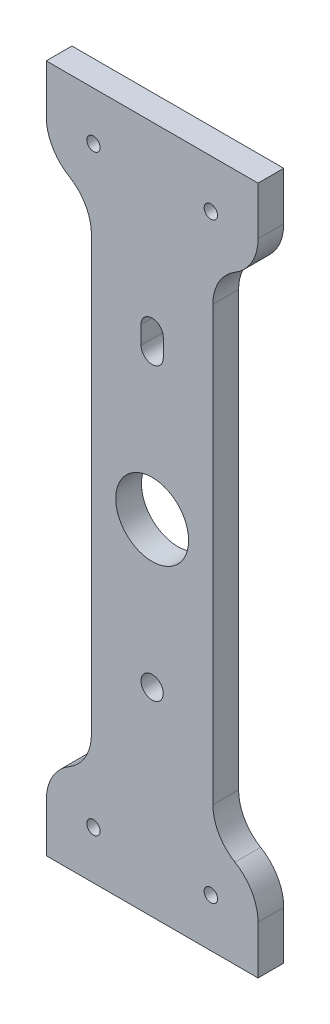
from build123d import *

# Parameters (mm, degrees)
SKETCH1_R           = 9
SKETCH1_R_2         = 1.65
SKETCH1_R_3         = 2.75
BOSS_EXTRUDE1_DEPTH = 6.35


with BuildPart() as part:
    # Sketch1 → Boss-Extrude1 (new body)
    with BuildSketch(Plane.XY):
        with BuildLine():
            Line((-15, -53.494834214), (-15, 53.494834214))
            ThreePointArc((-15, 53.494834214), (-16.458587943, 59.008365963), (-20.452741228, 63.079391714))
            ThreePointArc((-20.452741228, 63.079391714), (-24.626004526, 67.332974675), (-26.15, 73.09375))
            Line((-26.15, 73.09375), (-26.15, 85))
            Line((-26.15, 85), (26.15, 85))
            Line((26.15, 85), (26.15, 73.09375))
            ThreePointArc((26.15, 73.09375), (24.626004526, 67.332974675), (20.452741228, 63.079391714))
            ThreePointArc((20.452741228, 63.079391714), (16.458587943, 59.008365963), (15, 53.494834214))
            Line((15, 53.494834214), (15, -53.494834214))
            ThreePointArc((15, -53.494834214), (16.458587943, -59.008365963), (20.452741228, -63.079391714))
            ThreePointArc((20.452741228, -63.079391714), (24.626004526, -67.332974675), (26.15, -73.09375))
            Line((26.15, -73.09375), (26.15, -85))
            Line((26.15, -85), (-26.15, -85))
            Line((-26.15, -85), (-26.15, -73.09375))
            ThreePointArc((-26.15, -73.09375), (-24.626004526, -67.332974675), (-20.452741228, -63.079391714))
            ThreePointArc((-20.452741228, -63.079391714), (-16.458587943, -59.008365963), (-15, -53.494834214))
        make_face()
        Circle(SKETCH1_R, mode=Mode.SUBTRACT)
        with Locations((14.5, 73.09375)):
            Circle(SKETCH1_R_2, mode=Mode.SUBTRACT)
        with Locations((-14.5, 73.09375)):
            Circle(SKETCH1_R_2, mode=Mode.SUBTRACT)
        with Locations((14.5, -73.09375)):
            Circle(SKETCH1_R_2, mode=Mode.SUBTRACT)
        with Locations((-14.5, -73.09375)):
            Circle(SKETCH1_R_2, mode=Mode.SUBTRACT)
        with Locations((0, -35.8890625)):
            Circle(SKETCH1_R_3, mode=Mode.SUBTRACT)
        with BuildLine():
            Line((2.75, 40.3109375), (2.75, 35.8890625))
            ThreePointArc((2.75, 35.8890625), (0, 33.1390625), (-2.75, 35.8890625))
            Line((-2.75, 35.8890625), (-2.75, 40.3109375))
            ThreePointArc((-2.75, 40.3109375), (0, 43.0609375), (2.75, 40.3109375))
        make_face(mode=Mode.SUBTRACT)
    extrude(amount=BOSS_EXTRUDE1_DEPTH)


solid = part.part
